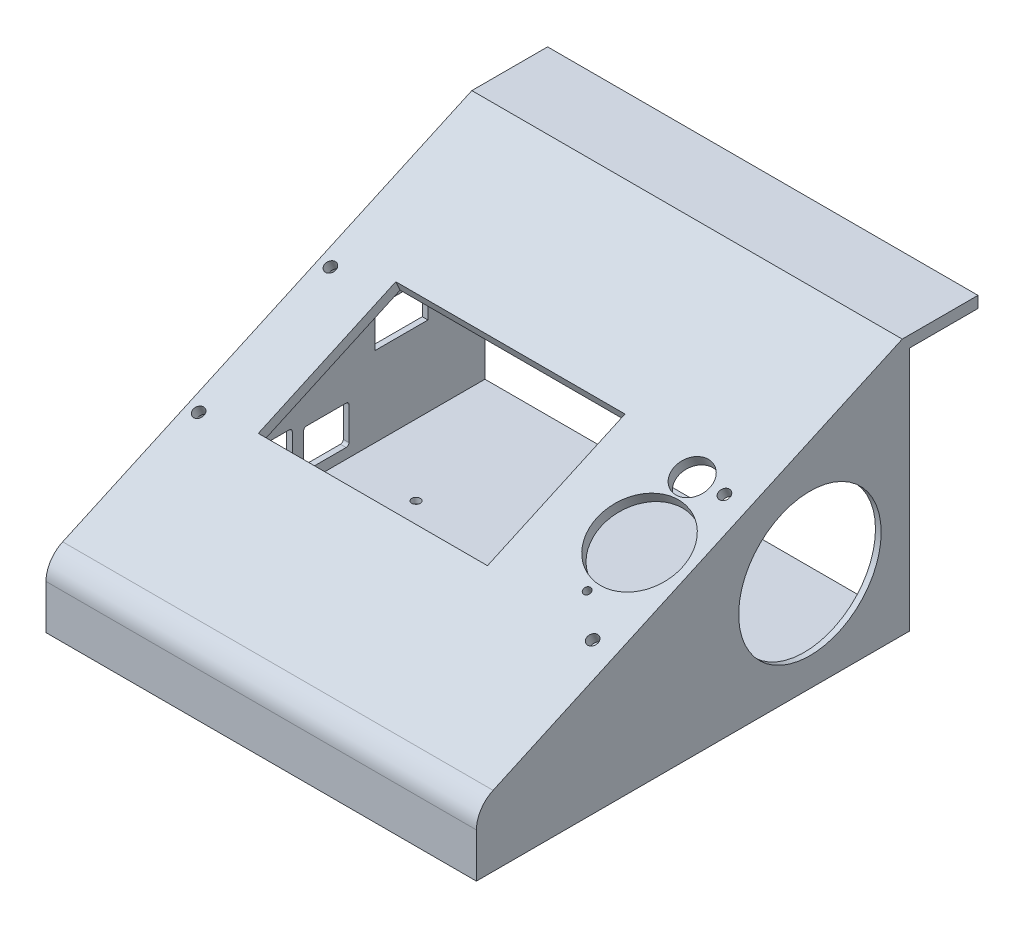
from build123d import *

# Parameters (mm, degrees)
SKETCH2_W           = 151
SKETCH2_H           = 152
BOSS_EXTRUDE1_DEPTH = 2
EXTRUDE_THIN1_DEPTH = 20
BOSS_EXTRUDE3_START = 75.5
BOSS_EXTRUDE3_DEPTH = 151
BOSS_EXTRUDE4_DEPTH = 2
BOSS_EXTRUDE5_DEPTH = 2
SKETCH8_R           = 25
CUT_EXTRUDE1_DEPTH  = 2
SKETCH9_W           = 80.4
SKETCH9_H           = 53
CUT_EXTRUDE6_DEPTH  = 10
SKETCH10_R          = 6.25
CUT_EXTRUDE7_DEPTH  = 10
SKETCH11_R          = 15
CUT_EXTRUDE8_DEPTH  = 10
SKETCH12_R          = 1.9
SKETCH12_R_2        = 1.27
CUT_EXTRUDE9_DEPTH  = 10
FILLET2_R           = 10
SKETCH15_W          = 18.5
SKETCH15_H          = 13
CUT_EXTRUDE12_DEPTH = 10
CUT_EXTRUDE13_DEPTH = 10
FILLET5_R           = 1
FILLET6_R           = 1
FILLET7_R           = 1
FILLET8_R           = 1
FILLET9_R           = 1
FILLET10_R          = 1
FILLET11_R          = 1
FILLET12_R          = 1
FILLET13_R          = 1
FILLET14_R          = 1
FILLET15_R          = 1
FILLET16_R          = 1
SKETCH19_R          = 1.5
CUT_EXTRUDE14_DEPTH = 10
FILLET17_R          = 10
FILLET19_R          = 10.42


with BuildPart() as part:
    # Sketch2 → Boss-Extrude1 (new body)
    with BuildSketch(Plane(origin=(0, 0, 0), x_dir=(1, 0, 0), z_dir=(0, 1, 0))):
        with Locations((0, -76)):
            Rectangle(SKETCH2_W, SKETCH2_H)
    extrude(amount=BOSS_EXTRUDE1_DEPTH)

    # Sketch3 → Extrude-Thin1 (add)
    with BuildSketch(Plane(origin=(0, 2, 0), x_dir=(1, 0, 0), z_dir=(0, 1, 0))):
        Polygon((-75.5, 0), (-75.5, -152), (75.5, -152), (75.5, 0), (73.5, 0), (73.5, -150), (-73.5, -150), (-73.5, 0), align=None)
    extrude(amount=EXTRUDE_THIN1_DEPTH)

    # Sketch4 → Boss-Extrude3 (add)
    with BuildSketch(Plane(origin=(0, 0, 0), x_dir=(0, 0, -1), z_dir=(1, 0, 0)).offset(BOSS_EXTRUDE3_START)):
        Polygon((0, 86), (23.969061552, 86), (23.969061552, 90), (0, 90), (-2.606060606, 90), (-152, 22), (-143.212121212, 22), (-2.606060606, 86), align=None)
    extrude(amount=-BOSS_EXTRUDE3_DEPTH)

    # Sketch6 → Boss-Extrude4 (add)
    with BuildSketch(Plane(origin=(75.5, 0, 0), x_dir=(0, 0, -1), z_dir=(1, 0, 0))):
        Polygon((0, 22), (-143.212121212, 22), (-2.606060606, 86), (0, 86), align=None)
    extrude(amount=-BOSS_EXTRUDE4_DEPTH)

    # Sketch7 → Boss-Extrude5 (add)
    with BuildSketch(Plane.ZY.offset(75.5)):
        Polygon((0, 86), (0, 22), (143.212121212, 22), (2.606060606, 86), align=None)
    extrude(amount=-BOSS_EXTRUDE5_DEPTH)

    # Sketch8 → Cut-Extrude1 (cut)
    with BuildSketch(Plane(origin=(75.5, 0, 0), x_dir=(0, 0, -1), z_dir=(1, 0, 0))):
        with Locations((-35, 35)):
            Circle(SKETCH8_R)
    extrude(amount=-CUT_EXTRUDE1_DEPTH, mode=Mode.SUBTRACT)

    # Sketch9 → Cut-Extrude6 (cut)
    with BuildSketch(Plane(origin=(0, 75.536424885, 34.382096844), x_dir=(1, 0, 0), z_dir=(0, 0.9101513920874156, 0.41427580605357506))):
        with Locations((-12.9, -45.503721555)):
            Rectangle(SKETCH9_W, SKETCH9_H)
    extrude(amount=-CUT_EXTRUDE6_DEPTH, mode=Mode.SUBTRACT)

    # Sketch10 → Cut-Extrude7 (cut)
    with BuildSketch(Plane(origin=(0, 75.536424885, 34.382096844), x_dir=(1, 0, 0), z_dir=(0, 0.9101513920874156, 0.41427580605357506))):
        with Locations(Location((55.95, -24.579806444, 0), (0, 0, 270))):
            Circle(SKETCH10_R)
    extrude(amount=-CUT_EXTRUDE7_DEPTH, mode=Mode.SUBTRACT)

    # Sketch11 → Cut-Extrude8 (cut)
    with BuildSketch(Plane(origin=(0, 75.536424885, 34.382096844), x_dir=(1, 0, 0), z_dir=(0, 0.9101513920874156, 0.41427580605357506))):
        with Locations(Location((57.5, -46.579806444, 0), (0, 0, 270))):
            Circle(SKETCH11_R)
    extrude(amount=-CUT_EXTRUDE8_DEPTH, mode=Mode.SUBTRACT)

    # Sketch12 → Cut-Extrude9 (cut)
    with BuildSketch(Plane(origin=(0, 75.536424885, 34.382096844), x_dir=(1, 0, 0), z_dir=(0, 0.9101513920874156, 0.41427580605357506))):
        with Locations(Location((67, -24.279806444, 0), (0, 0, 270))):
            Circle(SKETCH12_R)
        with Locations(Location((67, -75.079806444, 0), (0, 0, 270))):
            Circle(SKETCH12_R)
        with Locations(Location((-71.25, -24.279806444, 0), (0, 0, 270))):
            Circle(SKETCH12_R)
        with Locations(Location((-71.25, -75.079806444, 0), (0, 0, 270))):
            Circle(SKETCH12_R)
        with Locations(Location((55.5, -64.579806444, 0), (0, 0, 270))):
            Circle(SKETCH12_R_2)
    extrude(amount=-CUT_EXTRUDE9_DEPTH, mode=Mode.SUBTRACT)

    # Fillet2
    fillet2_edges = [part.edges().sort_by_distance(p)[0] for p in [
        (0, 22, 152),
    ]]
    fillet(fillet2_edges, radius=FILLET2_R)

    # Sketch15 → Cut-Extrude12 (cut)
    with BuildSketch(Plane.ZY.offset(75.5)):
        with Locations((29.25, 36.5)):
            Rectangle(SKETCH15_W, SKETCH15_H)
    extrude(amount=-CUT_EXTRUDE12_DEPTH, mode=Mode.SUBTRACT)

    # Sketch18 → Cut-Extrude13 (cut)
    with BuildSketch(Plane.ZY.offset(75.5)):
        Polygon((48.006551759, 19.1), (47.706551759, 19.1), (47.706551759, 5.6), (63.606551759, 5.6), (63.606551759, 19.1), align=None)
        Polygon((80.107551094, 20.95), (80.707551094, 20.95), (80.707551094, 6.575), (67.607551094, 6.534667741), (67.607551094, 20.95), align=None)
        Polygon((98.507551094, 20.95), (99.107551094, 20.95), (99.107551094, 6.575), (86.007551094, 6.575), (86.007551094, 20.95), align=None)
    extrude(amount=-CUT_EXTRUDE13_DEPTH, mode=Mode.SUBTRACT)

    # Fillet5
    fillet5_edges = [part.edges().sort_by_distance(p)[0] for p in [
        (-74.5, 20.95, 99.107551094),
    ]]
    fillet(fillet5_edges, radius=FILLET5_R)

    # Fillet6
    fillet6_edges = [part.edges().sort_by_distance(p)[0] for p in [
        (-74.5, 20.95, 86.007551094),
    ]]
    fillet(fillet6_edges, radius=FILLET6_R)

    # Fillet7
    fillet7_edges = [part.edges().sort_by_distance(p)[0] for p in [
        (-74.5, 6.575, 86.007551094),
    ]]
    fillet(fillet7_edges, radius=FILLET7_R)

    # Fillet8
    fillet8_edges = [part.edges().sort_by_distance(p)[0] for p in [
        (-74.5, 6.575, 99.107551094),
    ]]
    fillet(fillet8_edges, radius=FILLET8_R)

    # Fillet9
    fillet9_edges = [part.edges().sort_by_distance(p)[0] for p in [
        (-74.5, 20.95, 80.707551094),
    ]]
    fillet(fillet9_edges, radius=FILLET9_R)

    # Fillet10
    fillet10_edges = [part.edges().sort_by_distance(p)[0] for p in [
        (-74.5, 6.534667741, 67.607551094),
    ]]
    fillet(fillet10_edges, radius=FILLET10_R)

    # Fillet11
    fillet11_edges = [part.edges().sort_by_distance(p)[0] for p in [
        (-74.5, 20.95, 67.607551094),
    ]]
    fillet(fillet11_edges, radius=FILLET11_R)

    # Fillet12
    fillet12_edges = [part.edges().sort_by_distance(p)[0] for p in [
        (-74.5, 6.575, 80.707551094),
    ]]
    fillet(fillet12_edges, radius=FILLET12_R)

    # Fillet13
    fillet13_edges = [part.edges().sort_by_distance(p)[0] for p in [
        (-74.5, 19.1, 63.606551759),
    ]]
    fillet(fillet13_edges, radius=FILLET13_R)

    # Fillet14
    fillet14_edges = [part.edges().sort_by_distance(p)[0] for p in [
        (-74.5, 19.1, 47.706551759),
    ]]
    fillet(fillet14_edges, radius=FILLET14_R)

    # Fillet15
    fillet15_edges = [part.edges().sort_by_distance(p)[0] for p in [
        (-74.5, 5.6, 47.706551759),
    ]]
    fillet(fillet15_edges, radius=FILLET15_R)

    # Fillet16
    fillet16_edges = [part.edges().sort_by_distance(p)[0] for p in [
        (-74.5, 5.6, 63.606551759),
    ]]
    fillet(fillet16_edges, radius=FILLET16_R)

    # Sketch19 → Cut-Extrude14 (cut)
    with BuildSketch(Plane.XZ):
        with Locations(Location((9.358907141, 98.041860309, 0), (0, 0, 270))):
            Circle(SKETCH19_R)
        with Locations(Location((-48.641092859, 98.041860309, 0), (0, 0, 270))):
            Circle(SKETCH19_R)
        with Locations(Location((-48.641092859, 49.041860309, 0), (0, 0, 270))):
            Circle(SKETCH19_R)
        with Locations(Location((9.358907141, 49.041860309, 0), (0, 0, 270))):
            Circle(SKETCH19_R)
    extrude(amount=-CUT_EXTRUDE14_DEPTH, mode=Mode.SUBTRACT)

    # Fillet17
    fillet17_edges = [part.edges().sort_by_distance(p)[0] for p in [
        (0, 22, 143.212121212),
    ]]
    fillet(fillet17_edges, radius=FILLET17_R)

    # Fillet19
    # the kernel refuses this fillet: 10.42 mm, written as the material it adds along each edge
    with BuildSketch(Plane(origin=(-73.5, -24.05, 150), x_dir=(0, 0, -1), z_dir=(0, 1, 0))) as fillet19_piece_1_section:
        with BuildLine():
            CenterArc((FILLET19_R, -FILLET19_R), FILLET19_R, 90, 90)
            Line((0, -FILLET19_R), (0, 0))
            Line((0, 0), (FILLET19_R, 0))
        make_face()
    fillet19_piece_1 = extrude(amount=72.1, mode=Mode.PRIVATE)
    fillet19_piece_1 = split(fillet19_piece_1, bisect_by=Plane(origin=(-73.5, 11.537299555, 166.198357039), z_dir=(0, -0.9101513920874158, -0.41427580605357495)), keep=Keep.TOP, mode=Mode.PRIVATE)
    fillet19_piece_1 = split(fillet19_piece_1, bisect_by=Plane(origin=(-73.5, 0, 150), z_dir=(0, 1, 0)), keep=Keep.TOP, mode=Mode.PRIVATE)
    with BuildSketch(Plane(origin=(-73.5, -24.05, 150), x_dir=(0, 0, -1), z_dir=(0, 1, 0))) as fillet19_piece_2_section:
        with BuildLine():
            CenterArc((FILLET19_R, -FILLET19_R), FILLET19_R, 90, 90)
            Line((0, -FILLET19_R), (0, 0))
            Line((0, 0), (FILLET19_R, 0))
        make_face()
    fillet19_piece_2 = extrude(amount=72.1, mode=Mode.PRIVATE)
    fillet19_piece_2 = fillet19_piece_2 & Plane(origin=(-73.5, 15.564541031, 142), x_dir=(0, 0, 1), z_dir=(1, 0, 0)) * Cylinder(10, 186, mode=Mode.PRIVATE)
    with BuildSketch(Plane(origin=(73.5, -24.05, 150), x_dir=(-1, 0, 0), z_dir=(0, 1, 0))) as fillet19_piece_3_section:
        with BuildLine():
            CenterArc((FILLET19_R, -FILLET19_R), FILLET19_R, 90, 90)
            Line((0, -FILLET19_R), (0, 0))
            Line((0, 0), (FILLET19_R, 0))
        make_face()
    fillet19_piece_3 = extrude(amount=72.1, mode=Mode.PRIVATE)
    fillet19_piece_3 = split(fillet19_piece_3, bisect_by=Plane(origin=(73.5, 11.537299555, 166.198357039), z_dir=(0, -0.9101513920874158, -0.41427580605357495)), keep=Keep.TOP, mode=Mode.PRIVATE)
    fillet19_piece_3 = split(fillet19_piece_3, bisect_by=Plane(origin=(73.5, 0, 150), z_dir=(0, 1, 0)), keep=Keep.TOP, mode=Mode.PRIVATE)
    with BuildSketch(Plane(origin=(73.5, -24.05, 150), x_dir=(-1, 0, 0), z_dir=(0, 1, 0))) as fillet19_piece_4_section:
        with BuildLine():
            CenterArc((FILLET19_R, -FILLET19_R), FILLET19_R, 90, 90)
            Line((0, -FILLET19_R), (0, 0))
            Line((0, 0), (FILLET19_R, 0))
        make_face()
    fillet19_piece_4 = extrude(amount=72.1, mode=Mode.PRIVATE)
    fillet19_piece_4 = fillet19_piece_4 & Plane(origin=(73.5, 15.564541031, 142), x_dir=(0, 0, 1), z_dir=(1, 0, 0)) * Cylinder(10, 186, mode=Mode.PRIVATE)
    with BuildSketch(Plane(origin=(99.55, 2, 150), x_dir=(0, 1, 0), z_dir=(-1, 0, 0))) as fillet19_piece_5_section:
        with BuildLine():
            CenterArc((FILLET19_R, FILLET19_R), FILLET19_R, 180, 90)
            Line((0, FILLET19_R), (0, 0))
            Line((0, 0), (FILLET19_R, 0))
        make_face()
    fillet19_piece_5 = extrude(amount=199.1, mode=Mode.PRIVATE)
    fillet19_piece_5 = split(fillet19_piece_5, bisect_by=Plane(origin=(-75.5, 2, 150), z_dir=(1, 0, 0)), keep=Keep.TOP, mode=Mode.PRIVATE)
    fillet19_piece_5 = split(fillet19_piece_5, bisect_by=Plane(origin=(75.5, 2, 150), z_dir=(-1, 0, 0)), keep=Keep.TOP, mode=Mode.PRIVATE)
    with BuildSketch(Plane(origin=(97.446755584, 22, 150), x_dir=(0, 0.055144349629415036, -0.9984783927075983), z_dir=(-1, 0, 0))) as fillet19_piece_6_section:
        with BuildLine():
            CenterArc((9.875933547, 10.138731334), FILLET19_R, 183.161141999, 73.496080828)
            Line((-0.528211305, 9.564127211), (-1.56862579, 9.506666798))
            Line((-1.56862579, 9.506666798), (-1.040414485, -0.057460412))
            Line((-1.040414485, -0.057460412), (0.057460412, -1.040414485))
            ThreePointArc((0.057460412, -1.040414485), (4.669499422, -0.785699017), (7.230776161, -1.013873133))
            Line((7.230776161, -1.013873133), (7.471245014, 0))
        make_face()
    fillet19_piece_6 = extrude(amount=194.893511169, mode=Mode.PRIVATE)
    fillet19_piece_6 = split(fillet19_piece_6, bisect_by=Plane(origin=(-75.5, 22, 150), z_dir=(1, 0, 0)), keep=Keep.TOP, mode=Mode.PRIVATE)
    fillet19_piece_6 = split(fillet19_piece_6, bisect_by=Plane(origin=(75.5, 22, 150), z_dir=(-1, 0, 0)), keep=Keep.TOP, mode=Mode.PRIVATE)
    fillet19_piece_6 = fillet19_piece_6 & Plane(origin=(97.446755584, 15.564541031, 142), x_dir=(0, 0, 1), z_dir=(1, 0, 0)) * Cylinder(10, 429, mode=Mode.PRIVATE)
    add([fillet19_piece_1, fillet19_piece_2, fillet19_piece_3, fillet19_piece_4, fillet19_piece_5, fillet19_piece_6])


solid = part.part
